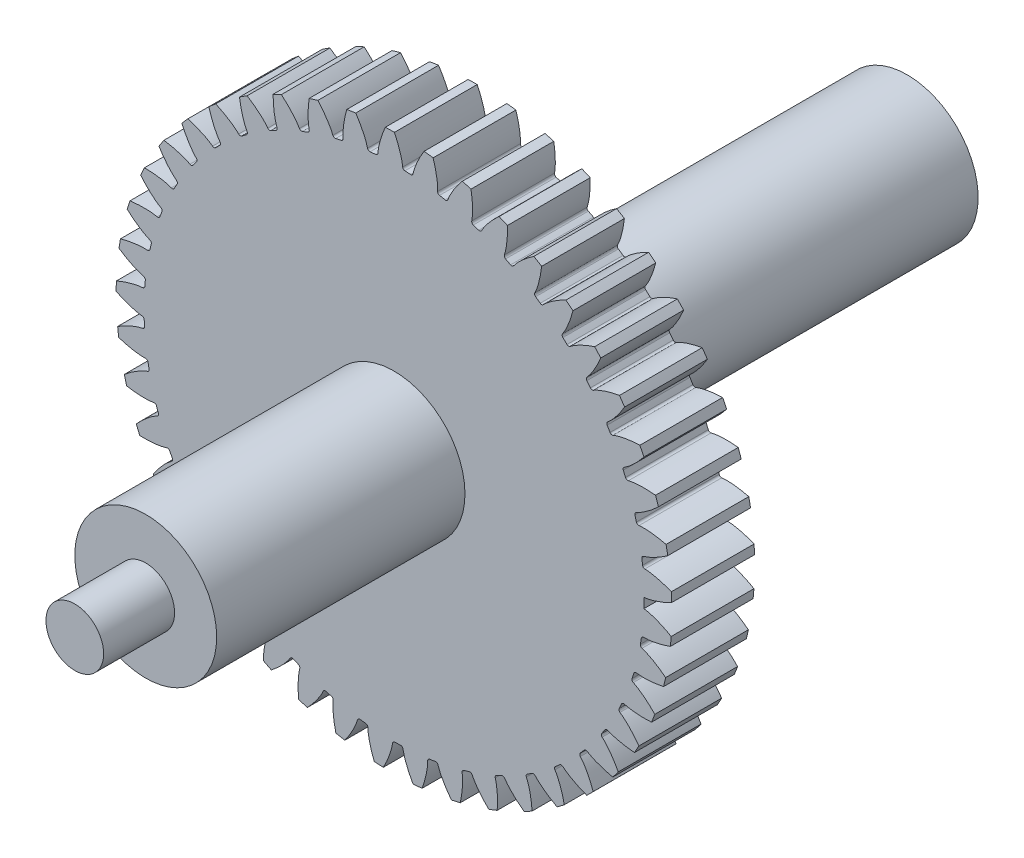
from build123d import *

# Parameters (mm, degrees)
SKETCH3_R           = 11.75
BOSS_EXTRUDE1_DEPTH = 3.5
CUT_EXTRUDE2_DEPTH  = 17.981607698
CIRPATTERN2_COUNT   = 45
FILLET1_R           = 0.1
SKETCH8_R           = 3
BOSS_EXTRUDE2_DEPTH = 13.5
CUT_EXTRUDE3_START  = -3
SKETCH9_R           = 3
SKETCH9_R_2         = 1.22
CUT_EXTRUDE3_DEPTH  = 3
SKETCH10_R          = 4
BOSS_EXTRUDE3_DEPTH = 18.2
SKETCH11_R          = 4
SKETCH11_R_2        = 3
CUT_EXTRUDE6_DEPTH  = 17.7
CUT_EXTRUDE7_DEPTH  = 13.7
CUT_EXTRUDE1_DEPTH  = 3.5


# Read off the part's stored shape, not the designer's step: Cut-Extrude1
with BuildPart() as part:
    # Sketch3 → Boss-Extrude1 (new body)
    with BuildSketch(Plane.XY):
        Circle(SKETCH3_R)
    extrude(amount=BOSS_EXTRUDE1_DEPTH)

    # Sketch4<3> → Cut-Extrude2 (cut, symmetric)
    with BuildSketch(Plane.XY):
        with BuildLine():
            add(Edge.make_bspline(
                [(10.571541984, 0), (10.575155906, 5.1993e-05), (10.585289514, 0.000358831), (10.604433962, 0.001574698), (10.635631655, 0.004460907), (10.675304987, 0.009463237), (10.726462446, 0.017447532), (10.786540991, 0.028802755), (10.852332657, 0.043319327), (10.923620009, 0.061304831), (10.994451275, 0.081181049), (11.064811755, 0.102801485), (11.134615067, 0.125952247), (11.218799361, 0.155893706), (11.319210292, 0.19443126), (11.435715697, 0.243289926), (11.561609943, 0.300826735), (11.655766555, 0.347454474), (11.7159692, 0.378543212), (11.74342574, 0.393003662)],
                knots=[0, 0, 0, 0, 0, 0.005376749, 0.015083688, 0.02853182, 0.04661014, 0.064854849, 0.092110525, 0.119476176, 0.146842496, 0.174208854, 0.201574956, 0.228941013, 0.256307345, 0.307035032, 0.361767352, 0.416499661, 0.462763449, 0.462763449, 0.462763449, 0.462763449, 0.462763449], degree=4))
            ThreePointArc((10.571541984, 0), (10.569427281, -0.21144001), (10.563084017, -0.422795428))
            add(Edge.make_bspline(
                [(10.563084017, -0.422795428), (10.566692968, -0.422991913), (10.576806197, -0.423703786), (10.595886701, -0.425684338), (10.626944003, -0.429815951), (10.666385532, -0.436400963), (10.71718274, -0.446424848), (10.77675908, -0.460173751), (10.841917536, -0.477309964), (10.912428546, -0.498132125), (10.982408218, -0.520825248), (11.051847723, -0.545242363), (11.120669302, -0.571166299), (11.203588772, -0.604450646), (11.302378106, -0.646973176), (11.416836259, -0.700452238), (11.540328669, -0.762977994), (11.632545131, -0.813334102), (11.691456256, -0.846805695), (11.718312501, -0.862352666)],
                knots=[0, 0, 0, 0, 0, 0.005376749, 0.015083688, 0.02853182, 0.04661014, 0.064854849, 0.092110525, 0.119476176, 0.146842496, 0.174208854, 0.201574956, 0.228941013, 0.256307345, 0.307035032, 0.361767352, 0.416499661, 0.462763449, 0.462763449, 0.462763449, 0.462763449, 0.462763449], degree=4))
            ThreePointArc((11.718312501, -0.862352666), (11.742075453, -0.431467327), (11.75, 0))
            ThreePointArc((11.75, 0), (11.74835632, 0.196529323), (11.74342574, 0.393003662))
        make_face()
    cut_extrude2 = extrude(amount=CUT_EXTRUDE2_DEPTH, both=True, mode=Mode.SUBTRACT)

    # CirPattern2: Cut-Extrude2 ×45 about axis
    cirpattern2_axis = Axis((0, 0, 0), (0, 0, 1))
    for i in range(1, CIRPATTERN2_COUNT):
        add(cut_extrude2.rotate(cirpattern2_axis, i * 360 / CIRPATTERN2_COUNT), mode=Mode.SUBTRACT)

    # Fillet1
    fillet1_edges = [part.edges().sort_by_distance(p)[0] for p in [
        (10.401443058, -1.88877797, 1.75),
        (10.468660464, -1.47127428, 1.75),
        (10.037349842, -3.317997597, 1.75),
        (10.162018376, -2.913911879, 1.75),
        (9.477891029, -4.682636176, 1.75),
        (9.65758416, -4.299833499, 1.75),
        (8.733955848, -5.956132568, 1.75),
        (8.965176053, -5.60206375, 1.75),
        (7.820024151, -7.113699614, 1.75),
        (8.098270992, -6.795256202, 1.75),
        (6.753884579, -8.132806589, 1.75),
        (7.073742298, -7.856186723, 1.75),
        (5.556288326, -8.993617735, 1.75),
        (5.911531256, -8.764205504, 1.75),
        (4.250545241, -9.679378341, 1.75),
        (4.634258983, -9.501638995, 1.75),
        (2.862070128, -10.176740858, 1.75),
        (3.26678613, -10.054133891, 1.75),
        (1.417888075, -10.476024691, 1.75),
        (1.835729001, -10.410936507, 1.75),
        (-0.053891556, -10.571404619, 1.75),
        (0.368941495, -10.565102086, 1.75),
        (-1.52462225, -10.461024181, 1.75),
        (-1.105027038, -10.513629971, 1.75),
        (-2.965677905, -10.147031806, 1.75),
        (-2.557487476, -10.257522007, 1.75),
        (-4.349010014, -9.635539, 1.75),
        (-3.96016933, -9.801763045, 1.75),
        (-5.647693589, -8.936501387, 1.75),
        (-5.285770992, -9.155223915, 1.75),
        (-6.836451233, -8.06352494, 1.75),
        (-6.508491134, -8.330488765, 1.75),
        (-7.89214513, -7.033601152, 1.75),
        (-7.6045309, -7.343610128, 1.75),
        (-8.7942274, -5.866776318, 1.75),
        (-8.552557122, -6.213796472, 1.75),
        (-9.525140036, -4.585761356, 1.75),
        (-9.334117547, -4.963038336, 1.75),
        (-10.070656656, -3.215489766, 1.75),
        (-9.933999993, -3.615680304, 1.75),
        (-10.420159399, -1.782632325, 1.75),
        (-10.340528428, -2.197947168, 1.75),
        (-10.566845593, -0.315077974, 1.75),
        (-10.545790239, -0.737433491, 1.75),
        (-10.507860157, 1.158609012, 1.75),
        (-10.545790239, 0.737433491, 1.75),
        (-10.244351175, 2.609744991, 1.75),
        (-10.340528428, 2.197947168, 1.75),
        (-9.78144755, 4.010085253, 1.75),
        (-9.933999993, 3.615680304, 1.75),
        (-9.128159176, 5.332373766, 1.75),
        (-9.334117547, 4.963038336, 1.75),
        (-8.297201565, 6.55087369, 1.75),
        (-8.552557122, 6.213796472, 1.75),
        (-7.304748365, 7.641868308, 1.75),
        (-7.6045309, 7.343610128, 1.75),
        (-6.170116546, 8.584122653, 1.75),
        (-6.508491134, 8.330488765, 1.75),
        (-4.915390427, 9.359296815, 1.75),
        (-5.285770992, 9.155223915, 1.75),
        (-3.564991825, 9.95230291, 1.75),
        (-3.96016933, 9.801763045, 1.75),
        (-2.145204712, 10.351598749, 1.75),
        (-2.557487476, 10.257522007, 1.75),
        (-0.68366363, 10.549412493, 1.75),
        (-1.105027038, 10.513629971, 1.75),
        (0.791184188, 10.541893924, 1.75),
        (0.368941495, 10.565102086, 1.75),
        (2.250632505, 10.32918938, 1.75),
        (1.835729001, 10.410936507, 1.75),
        (3.666274821, 9.915438914, 1.75),
        (3.26678613, 10.054133891, 1.75),
        (5.010557267, 9.308695708, 1.75),
        (4.634258983, 9.501638995, 1.75),
        (6.257314916, 8.520769329, 1.75),
        (5.911531256, 8.764205504, 1.75),
        (7.382281047, 7.566995867, 1.75),
        (7.073742298, 7.856186723, 1.75),
        (8.363559475, 6.465939438, 1.75),
        (8.098270992, 6.795256202, 1.75),
        (9.182050732, 5.239030853, 1.75),
        (8.965176053, 5.60206375, 1.75),
        (9.821823815, 3.910150491, 1.75),
        (9.65758416, 4.299833499, 1.75),
        (10.27042627, 2.505163498, 1.75),
        (10.162018376, 2.913911879, 1.75),
        (10.563084017, -0.422795428, 1.75),
        (10.571541984, 0, 1.75),
        (10.468660464, 1.47127428, 1.75),
        (10.51912656, 1.051416347, 1.75),
    ]]
    fillet(fillet1_edges, radius=FILLET1_R)

    # Sketch8 → Boss-Extrude2 (add)
    with BuildSketch(Plane.XY.offset(3.5)):
        Circle(SKETCH8_R)
    extrude(amount=BOSS_EXTRUDE2_DEPTH)

    # Sketch9 → Cut-Extrude3 (cut)
    with BuildSketch(Plane.XY.offset(17).offset(CUT_EXTRUDE3_START)):
        Circle(SKETCH9_R)
        Circle(SKETCH9_R_2, mode=Mode.SUBTRACT)
    extrude(amount=CUT_EXTRUDE3_DEPTH, mode=Mode.SUBTRACT)

    # Sketch10 → Boss-Extrude3 (add)
    with BuildSketch(Plane(origin=(0, 0, 0), x_dir=(-1, 0, 0), z_dir=(0, 0, -1))):
        with Locations(Location((0, 0, 0), (0, 0, 180))):
            Circle(SKETCH10_R)
    extrude(amount=BOSS_EXTRUDE3_DEPTH)

    # Sketch11 → Cut-Extrude6 (cut)
    with BuildSketch(Plane(origin=(0, 0, -18.2), x_dir=(-1, 0, 0), z_dir=(0, 0, -1))):
        with Locations(Location((0, 0, 0), (0, 0, 180))):
            Circle(SKETCH11_R)
        with Locations(Location((0, 0, 0), (0, 0, 180))):
            Circle(SKETCH11_R_2, mode=Mode.SUBTRACT)
    extrude(amount=-CUT_EXTRUDE6_DEPTH, mode=Mode.SUBTRACT)

    # Sketch15 → Cut-Extrude7 (cut)
    with BuildSketch(Plane(origin=(0, 0, -18.2), x_dir=(-1, 0, 0), z_dir=(0, 0, -1))):
        with BuildLine():
            Line((2.5, 1.658312395), (2.5, -1.658312395))
            ThreePointArc((2.5, -1.658312395), (3, 0), (2.5, 1.658312395))
        make_face()
    extrude(amount=-CUT_EXTRUDE7_DEPTH, mode=Mode.SUBTRACT)

    # Cut-Extrude1 outline → Cut-Extrude1 (cut)
    with BuildSketch(Plane.XY):
        with BuildLine():
            add(Edge.make_bspline(
                [(10.658333914, 0.007446974), (10.655745038, 0.007112482), (10.644187657, 0.005649529), (10.626130693, 0.003581939), (10.604433962, 0.001574698), (10.585289514, 0.000358831), (10.575155906, 5.1993e-05), (10.571541984, 0)],
                knots=[0.876675453, 0.876675453, 0.876675453, 0.876675453, 0.876675453, 0.880559095, 0.894007227, 0.903714166, 0.909090915, 0.909090915, 0.909090915, 0.909090915, 0.909090915], degree=4))
            ThreePointArc((10.571541984, 0), (10.571444347, -0.045434967), (10.571151438, -0.090869094))
            ThreePointArc((10.571151438, -0.090869094), (10.596327666, -0.025381419), (10.658333914, 0.007446974))
        make_face()
        with BuildLine():
            ThreePointArc((10.649508675, -0.433707576), (10.588864967, -0.398425587), (10.566327977, -0.331983416))
            ThreePointArc((10.566327977, -0.331983416), (10.564803572, -0.377392908), (10.563084017, -0.422795428))
            add(Edge.make_bspline(
                [(10.563084017, -0.422795428), (10.566692968, -0.422991913), (10.576806197, -0.423703786), (10.595886701, -0.425684338), (10.617485796, -0.428557707), (10.635445622, -0.431345808), (10.646935248, -0.433269814), (10.649508675, -0.433707576)],
                knots=[0, 0, 0, 0, 0, 0.005376749, 0.015083688, 0.02853182, 0.032415462, 0.032415462, 0.032415462, 0.032415462, 0.032415462], degree=4))
        make_face()
    extrude(amount=CUT_EXTRUDE1_DEPTH, mode=Mode.SUBTRACT)


solid = part.part
